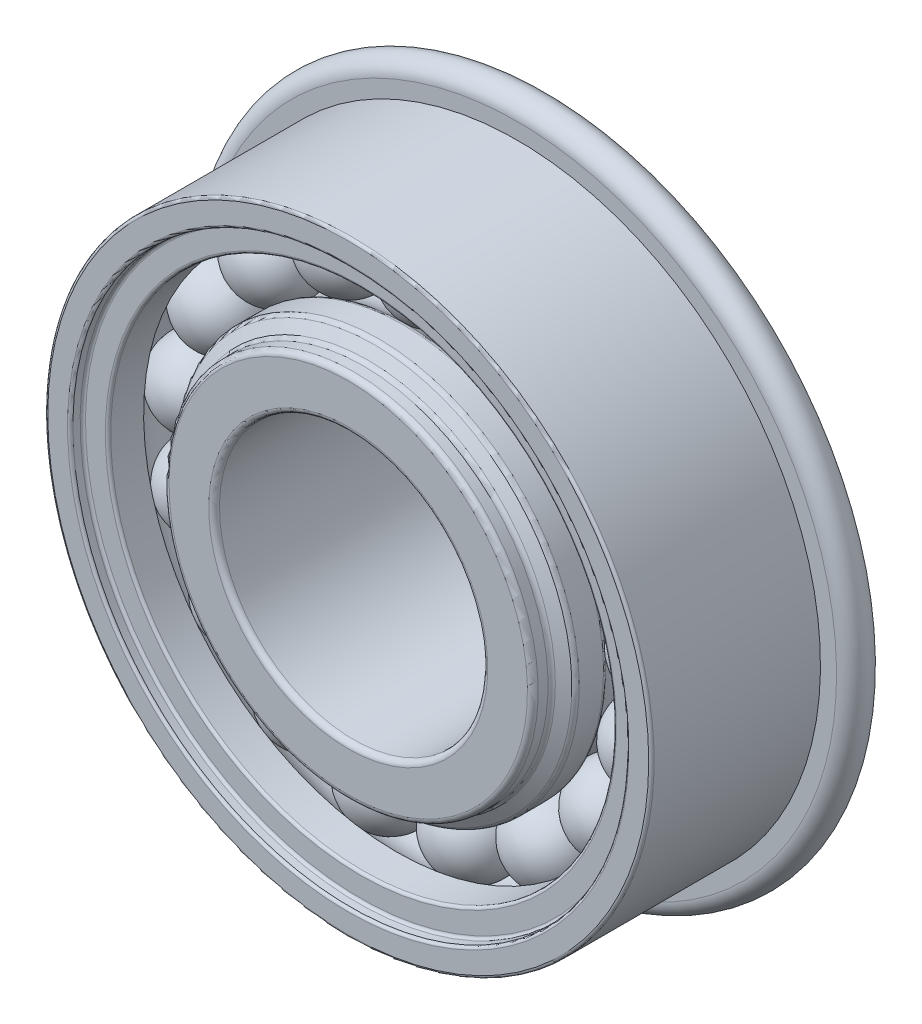
from build123d import *

# Parameters (mm, degrees)
FILLET4_R          = 0.762
CIRPATTERN3_COUNT  = 17
FILLET2_R          = 0.127
FILLET3_R          = 0.127
FILLET5_R          = 0.254
SKETCH12_R         = 13.540581249999997
SKETCH12_R_2       = 11.968162499999998
CUT_EXTRUDE1_DEPTH = 1.143


with BuildPart() as part:
    # Sketch2 → Revolve1 (revolve)
    with BuildSketch(Plane(origin=(0, 0, 0), x_dir=(0, 0, -1), z_dir=(1, 0, 0)), mode=Mode.PRIVATE) as revolve1_sk:
        with BuildLine():
            Line((2.44475, 14.350999999999997), (-5.5562499999999995, 14.350999999999996))
            Line((-5.5562499999999995, 14.350999999999996), (-5.5562499999999995, 13.159581249999999))
            Line((-5.5562499999999995, 13.159581249999999), (-4.960540625000001, 13.159581249999999))
            Line((-4.960540625000001, 13.159581249999999), (-4.960540625000001, 11.9681625))
            Line((-4.960540625000001, 11.9681625), (-3.274269160634745, 11.9681625))
            ThreePointArc((-3.274269160634745, 11.9681625), (-1.55575, 12.96035), (0.1627691606347452, 11.9681625))
            Line((0.1627691606347452, 11.9681625), (3.9687500000000027, 11.9681625))
            Line((3.9687500000000027, 11.9681625), (3.96875, 15.112999999999998))
            ThreePointArc((3.96875, 15.112999999999998), (3.2067500000000018, 15.874999999999998), (2.4447500000000018, 15.113))
            Line((2.4447500000000018, 15.113), (2.44475, 14.350999999999997))
        make_face()
    revolve(revolve1_sk.sketch.rotate(Axis((0, 0, 5.5562499999999995), (0, 1.8e-16, -1)), 180), axis=Axis((0, 0, 5.5562499999999995), (0, 1.8e-16, -1)))

    # Fillet2
    fillet2_edges = [part.edges().sort_by_distance(p)[0] for p in [
        (-2.93e-15, 11.9681625, 4.960540625),
        (-3.22e-15, 13.159581249999999, 4.960540625000002),
    ]]
    fillet(fillet2_edges, radius=FILLET2_R)

    # Fillet3
    fillet3_edges = [part.edges().sort_by_distance(p)[0] for p in [
        (-3.22e-15, 13.159581249999999, 5.55625),
        (-3.51e-15, 14.350999999999996, 5.5562499999999995),
    ]]
    fillet(fillet3_edges, radius=FILLET3_R)

    # Sketch12 → Cut-Extrude1 (cut)
    with BuildSketch(Plane(origin=(0, 7.3e-16, -3.9687500000000044), x_dir=(-1, 0, 0), z_dir=(0, 1.8e-16, -1))):
        with Locations(Location((0, 1.02e-15, 0), (0, 0, 90))):
            Circle(SKETCH12_R)
        with Locations(Location((0, 1.02e-15, 0), (0, 0, 270))):
            Circle(SKETCH12_R_2, mode=Mode.SUBTRACT)
    extrude(amount=-CUT_EXTRUDE1_DEPTH, mode=Mode.SUBTRACT)


with BuildPart() as body_2:
    # Sketch3 → Revolve2 (revolve)
    with BuildSketch(Plane(origin=(0, 0, 0), x_dir=(0, 0, -1), z_dir=(1, 0, 0)), mode=Mode.PRIVATE) as revolve2_sk:
        with BuildLine():
            Line((-5.5562499999999995, 8.7376), (-4.690116343040088, 8.7376))
            Line((-4.690116343040088, 8.7376), (-4.257049514560134, 9.487693750000002))
            Line((-4.257049514560134, 9.487693750000002), (-2.8682906894734495, 9.487693750000002))
            ThreePointArc((-2.8682906894734495, 9.487693750000002), (-1.5557499999999995, 8.991600000000002), (-0.24320931052655032, 9.487693750000002))
            Line((-0.24320931052655032, 9.487693750000002), (2.0116831715200463, 9.487693750000002))
            Line((2.0116831715200463, 9.487693750000002), (2.44475, 8.737600000000002))
            Line((2.44475, 8.737600000000002), (5.55625, 8.7376))
            Line((5.55625, 8.7376), (5.55625, 6.350000000000001))
            Line((5.55625, 6.350000000000001), (-5.5562499999999995, 6.35))
            Line((-5.5562499999999995, 6.35), (-5.5562499999999995, 8.7376))
        make_face()
    revolve(revolve2_sk.sketch.rotate(Axis((0, 0, 5.5562499999999995), (0, 1.8e-16, -1)), 180), axis=Axis((0, 0, 5.5562499999999995), (0, 1.8e-16, -1)))

    # Sketch5 → Cut-Revolve2 (revolve, cut)
    with BuildSketch(Plane(origin=(0, 0, 0), x_dir=(0, 0, -1), z_dir=(1, 0, 0)), mode=Mode.PRIVATE) as cut_revolve2_sk:
        with BuildLine():
            Line((5.55625, 6.9469), (5.55625, 6.350000000000001))
            Line((5.55625, 6.350000000000001), (4.486349594525831, 6.350000000000001))
            Line((4.486349594525831, 6.350000000000001), (4.88662719634144, 6.38501975242221))
            ThreePointArc((4.88662719634144, 6.38501975242221), (5.310018678948872, 6.560394246711456), (5.55625, 6.9469))
        make_face()
    revolve(cut_revolve2_sk.sketch.rotate(Axis((0, 0, 5.5562499999999995), (0, 1.8e-16, -1)), 180), axis=Axis((0, 0, 5.5562499999999995), (0, 1.8e-16, -1)), mode=Mode.SUBTRACT)

    # Sketch6 → Cut-Revolve3 (revolve, cut)
    with BuildSketch(Plane(origin=(0, 0, 0), x_dir=(0, 0, -1), z_dir=(1, 0, 0)), mode=Mode.PRIVATE) as cut_revolve3_sk:
        with BuildLine():
            Line((5.310904840122577, 7.012640037456041), (5.55625, 6.9469))
            Line((5.55625, 6.9469), (5.55625, 7.045510056184058))
            Line((5.55625, 7.045510056184058), (5.188232260183865, 7.0455100561840585))
            ThreePointArc((5.188232260183865, 7.0455100561840585), (5.0651165996583005, 6.852257179539788), (4.853420858354586, 6.764569932395164))
            Line((4.853420858354586, 6.764569932395164), (3.968750000000001, 6.687171261337388))
            Line((3.968750000000001, 6.687171261337388), (3.96875, 6.559686141969385))
            Line((3.96875, 6.559686141969385), (4.864489637683538, 6.638053205737512))
            ThreePointArc((4.864489637683538, 6.638053205737512), (5.146750626088492, 6.754969535263678), (5.310904840122577, 7.012640037456041))
        make_face()
    revolve(cut_revolve3_sk.sketch.rotate(Axis((0, 0, 5.5562499999999995), (0, 1.8e-16, -1)), 180), axis=Axis((0, 0, 5.5562499999999995), (0, 1.8e-16, -1)), mode=Mode.SUBTRACT)

    # Fillet4
    # the kernel refuses this fillet: 0.762 mm, written as the material it takes off along each edge
    with BuildSketch(Plane(origin=(0, 2.04e-15, -5.556250000000001), x_dir=(1.2e-16, -1, -1.3e-16), z_dir=(1, 1.2e-16, 0))) as fillet4_piece_1:
        with BuildLine():
            CenterArc((7.697753859267347, -0.7619999999999979), FILLET4_R, 90, 58.86628583256041)
            Line((7.045510056184135, -0.3680177398161817), (7.032465180122471, -0.36013809461250545))
            ThreePointArc((7.032465180122471, -0.36013809461250545), (7.030270056184055, -0.18400886990808996), (7.030270056184055, 8.9e-16))
            Line((7.030270056184055, 8.9e-16), (7.045510056184056, 0.01524000000000125))
            Line((7.045510056184056, 0.01524000000000125), (7.697753859267347, 0.01524000000000295))
            Line((7.697753859267347, 0.01524000000000295), (7.697753859267347, 2.58e-15))
        make_face()
    revolve(axis=Axis((0, 2.04e-15, -5.556250000000001), (0, 1.8e-16, -1)), mode=Mode.SUBTRACT)

    # Sketch14 → Revolve4 (revolve)
    with BuildSketch(Plane(origin=(0, 0, 0), x_dir=(0, 0, -1), z_dir=(1, 0, 0)), mode=Mode.PRIVATE) as revolve4_sk:
        with BuildLine():
            Line((4.486349594525832, 6.350000000000002), (4.778354774951089, 6.350000000000003))
            ThreePointArc((4.778354774951089, 6.350000000000003), (5.26861251103332, 6.516420076453832), (5.556250000000002, 6.9469))
            Line((5.556250000000002, 6.9469), (5.433577420061289, 6.979770018728019))
            ThreePointArc((5.433577420061289, 6.979770018728019), (5.13515953827062, 6.578421647285627), (4.642781425733349, 6.49068601184526))
            Line((4.642781425733349, 6.49068601184526), (4.486349594525832, 6.477000000000003))
            Line((4.486349594525832, 6.477000000000003), (4.486349594525832, 6.350000000000002))
        make_face()
    revolve(revolve4_sk.sketch.rotate(Axis((0, 1.38e-15, -3.843895860272255), (0, -3.1e-16, 1)), 180), axis=Axis((0, 1.38e-15, -3.843895860272255), (0, -3.1e-16, 1)))

    # Sketch7 → Cut-Revolve4 (revolve, cut)
    with BuildSketch(Plane(origin=(0, 0, 0), x_dir=(0, 0, -1), z_dir=(1, 0, 0)), mode=Mode.PRIVATE) as cut_revolve4_sk:
        Polygon((5.55625, 8.140699999999999), (5.55625, 8.7376), (5.357283333333334, 8.7376), (5.357283333333334, 8.538633333333333), (5.357283333333334, 8.339666666666666), (5.357283333333334, 8.140699999999999), align=None)
    revolve(cut_revolve4_sk.sketch.rotate(Axis((0, 0, 5.5562499999999995), (0, 1.8e-16, -1)), 180), axis=Axis((0, 0, 5.5562499999999995), (0, 1.8e-16, -1)), mode=Mode.SUBTRACT)

    # Fillet5
    # the kernel refuses this fillet: 0.254 mm, written as the material it adds along each edge
    with BuildSketch(Plane(origin=(0, 1.6e-16, 4.690116343040086), x_dir=(1.2e-16, -1, -2e-16), z_dir=(1, 1.2e-16, 0))) as fillet5_piece_1:
        with BuildLine():
            CenterArc((8.7376 + FILLET5_R, -FILLET5_R * 0.57735026919), FILLET5_R, 120.00000000000017, 59.99999999999983)
            Line((8.7376 + FILLET5_R * 0.5, FILLET5_R * 0.288675134595), (8.7376, 0))
            Line((8.7376, 0), (8.7376, -FILLET5_R * 0.57735026919))
        make_face()
    revolve(axis=Axis((0, 1.6e-16, 4.690116343040086), (0, 1.8e-16, -1)))
    with BuildSketch(Plane(origin=(0, 1.47e-15, -2.4447500000000018), x_dir=(1.2e-16, -1, -2e-16), z_dir=(1, 1.2e-16, 0))) as fillet5_piece_2:
        with BuildLine():
            CenterArc((8.7376 + FILLET5_R, FILLET5_R * 0.57735026919), FILLET5_R, 180.00000000000028, 60.00000000000006)
            Line((8.7376, FILLET5_R * 0.57735026919), (8.7376, -4.4e-16))
            Line((8.7376, -4.4e-16), (8.7376 + FILLET5_R * 0.5, -FILLET5_R * 0.288675134595))
        make_face()
    revolve(axis=Axis((0, 1.47e-15, -2.4447500000000018), (0, 1.8e-16, -1)))
    # the kernel refuses this fillet: 0.254 mm, written as the material it takes off along each edge
    with BuildSketch(Plane(origin=(0, 0, 5.556249999999998), x_dir=(1.2e-16, -1, -1.4e-16), z_dir=(1, 1.2e-16, 0))) as fillet5_2_piece_1:
        with BuildLine():
            CenterArc((6.35 + FILLET5_R, FILLET5_R), FILLET5_R, 180.00000000000017, 89.99999999999983)
            Line((6.35, FILLET5_R), (6.35, 8.9e-16))
            Line((6.35, 8.9e-16), (6.35 + FILLET5_R, 8.5e-16))
        make_face()
    revolve(axis=Axis((0, 0, 5.556249999999998), (0, 1.8e-16, -1)), mode=Mode.SUBTRACT)
    with BuildSketch(Plane(origin=(0, 2.04e-15, -5.556250000000001), x_dir=(1.2e-16, -1, -2.2e-16), z_dir=(1, 1.2e-16, 0))) as fillet5_2_piece_2:
        with BuildLine():
            CenterArc((7.892733606666686, -0.2539999999999995), FILLET5_R, 12.513325362831626, 77.48667463716838)
            Line((7.892733606666686, 5e-17), (8.140699999999997, -8.9e-16))
            Line((8.140699999999997, -8.9e-16), (8.14069999999902, -0.198966666666883))
        make_face()
    revolve(axis=Axis((0, 2.04e-15, -5.556250000000001), (0, 1.8e-16, -1)), mode=Mode.SUBTRACT)
    with BuildSketch(Plane(origin=(0, 2e-15, -5.357283333333336), x_dir=(1.2e-16, -1, -2e-16), z_dir=(1, 1.2e-16, 0))) as fillet5_2_piece_3:
        with BuildLine():
            CenterArc((8.737599999999999 - FILLET5_R, -FILLET5_R), FILLET5_R, 1.8783e-13, 90.00000000000061)
            Line((8.737599999999999 - FILLET5_R, 9.4e-16), (8.737599999999999, 0))
            Line((8.737599999999999, 0), (8.7376, -FILLET5_R))
        make_face()
    revolve(axis=Axis((0, 2e-15, -5.357283333333336), (0, 1.8e-16, -1)), mode=Mode.SUBTRACT)
    with BuildSketch(Plane(origin=(0, 0, 5.556249999999998), x_dir=(1.2e-16, -1, -2e-16), z_dir=(1, 1.2e-16, 0))) as fillet5_2_piece_4:
        with BuildLine():
            CenterArc((8.7376 - FILLET5_R, FILLET5_R), FILLET5_R, 270, 90.00000000000017)
            Line((8.7376 - FILLET5_R, -8.4e-16), (8.7376, 0))
            Line((8.7376, 0), (8.7376, FILLET5_R))
        make_face()
    revolve(axis=Axis((0, 0, 5.556249999999998), (0, 1.8e-16, -1)), mode=Mode.SUBTRACT)
    with BuildSketch(Plane(origin=(0, 2.4e-16, 4.257049514560133), x_dir=(1.2e-16, -1, -1.9e-16), z_dir=(1, 1.2e-16, 0))) as fillet5_2_piece_5:
        with BuildLine():
            CenterArc((9.487693750000002 - FILLET5_R, FILLET5_R * 0.57735026919), FILLET5_R, 299.9999999999997, 60.00000000000028)
            Line((9.48769375, FILLET5_R * 0.57735026919), (9.487693750000002, 0))
            Line((9.487693750000002, 0), (9.487693750000002 - FILLET5_R * 0.5, -FILLET5_R * 0.288675134595))
        make_face()
    revolve(axis=Axis((0, 2.4e-16, 4.257049514560133), (0, 1.8e-16, -1)), mode=Mode.SUBTRACT)
    with BuildSketch(Plane(origin=(0, 4.9e-16, 2.8682906894734477), x_dir=(1.2e-16, -1, -1.9e-16), z_dir=(1, 1.2e-16, 0))) as fillet5_2_piece_6:
        with BuildLine():
            CenterArc((9.233693750000002, -0.09272750077474741), FILLET5_R, 360, 38.888534569344074)
            ThreePointArc((9.431399423758867, 0.06673555627469387), (9.459179515850213, 0.03305813785822177), (9.487693750000002, 0))
            Line((9.487693750000002, 0), (9.487693750000002, -0.09272750077474745))
        make_face()
    revolve(axis=Axis((0, 4.9e-16, 2.8682906894734477), (0, 1.8e-16, -1)), mode=Mode.SUBTRACT)
    with BuildSketch(Plane(origin=(0, 9.8e-16, 0.2432093105265487), x_dir=(1.2e-16, -1, -1.8e-16), z_dir=(1, 1.2e-16, 0))) as fillet5_2_piece_7:
        with BuildLine():
            CenterArc((9.233693750000002, 0.0927275007747528), FILLET5_R, 321.1114654306559, 38.888534569344124)
            Line((9.487693750000002, 0.09272750077475314), (9.487693750000002, 0))
            ThreePointArc((9.487693750000002, 0), (9.459179515850213, -0.03305813785821739), (9.431399423758867, -0.06673555627468837))
        make_face()
    revolve(axis=Axis((0, 9.8e-16, 0.2432093105265487), (0, 1.8e-16, -1)), mode=Mode.SUBTRACT)


with BuildPart() as body_3:
    # Sketch11 → Revolve3 (revolve)
    with BuildSketch(Plane(origin=(0, 0, 0), x_dir=(0, 0, -1), z_dir=(1, 0, 0))):
        with BuildLine():
            Line((-1.5557499999999997, 12.96035), (-1.5557499999999993, 8.9916))
            ThreePointArc((-1.5557499999999993, 8.9916), (0.42862500000000026, 10.975975), (-1.5557499999999997, 12.96035))
        make_face()
    revolve(axis=Axis((0, 12.96035, 1.5557499999999997), (0, -1, -1.1e-16)))


with BuildPart() as cirpattern3_1:
    # CirPattern3: pattern copy
    add(body_3.part.rotate(Axis((1e-16, -4.9e-16, 0), (0, 0, 1)), 1 * 360 / CIRPATTERN3_COUNT))


with BuildPart() as cirpattern3_2:
    # CirPattern3: pattern copy
    add(body_3.part.rotate(Axis((1e-16, -4.9e-16, 0), (0, 0, 1)), 2 * 360 / CIRPATTERN3_COUNT))


with BuildPart() as cirpattern3_3:
    # CirPattern3: pattern copy
    add(body_3.part.rotate(Axis((1e-16, -4.9e-16, 0), (0, 0, 1)), 3 * 360 / CIRPATTERN3_COUNT))


with BuildPart() as cirpattern3_4:
    # CirPattern3: pattern copy
    add(body_3.part.rotate(Axis((1e-16, -4.9e-16, 0), (0, 0, 1)), 4 * 360 / CIRPATTERN3_COUNT))


with BuildPart() as cirpattern3_5:
    # CirPattern3: pattern copy
    add(body_3.part.rotate(Axis((1e-16, -4.9e-16, 0), (0, 0, 1)), 5 * 360 / CIRPATTERN3_COUNT))


with BuildPart() as cirpattern3_6:
    # CirPattern3: pattern copy
    add(body_3.part.rotate(Axis((1e-16, -4.9e-16, 0), (0, 0, 1)), 6 * 360 / CIRPATTERN3_COUNT))


with BuildPart() as cirpattern3_7:
    # CirPattern3: pattern copy
    add(body_3.part.rotate(Axis((1e-16, -4.9e-16, 0), (0, 0, 1)), 7 * 360 / CIRPATTERN3_COUNT))


with BuildPart() as cirpattern3_8:
    # CirPattern3: pattern copy
    add(body_3.part.rotate(Axis((1e-16, -4.9e-16, 0), (0, 0, 1)), 8 * 360 / CIRPATTERN3_COUNT))


with BuildPart() as cirpattern3_9:
    # CirPattern3: pattern copy
    add(body_3.part.rotate(Axis((1e-16, -4.9e-16, 0), (0, 0, 1)), 9 * 360 / CIRPATTERN3_COUNT))


with BuildPart() as cirpattern3_10:
    # CirPattern3: pattern copy
    add(body_3.part.rotate(Axis((1e-16, -4.9e-16, 0), (0, 0, 1)), 10 * 360 / CIRPATTERN3_COUNT))


with BuildPart() as cirpattern3_11:
    # CirPattern3: pattern copy
    add(body_3.part.rotate(Axis((1e-16, -4.9e-16, 0), (0, 0, 1)), 11 * 360 / CIRPATTERN3_COUNT))


with BuildPart() as cirpattern3_12:
    # CirPattern3: pattern copy
    add(body_3.part.rotate(Axis((1e-16, -4.9e-16, 0), (0, 0, 1)), 12 * 360 / CIRPATTERN3_COUNT))


with BuildPart() as cirpattern3_13:
    # CirPattern3: pattern copy
    add(body_3.part.rotate(Axis((1e-16, -4.9e-16, 0), (0, 0, 1)), 13 * 360 / CIRPATTERN3_COUNT))


with BuildPart() as cirpattern3_14:
    # CirPattern3: pattern copy
    add(body_3.part.rotate(Axis((1e-16, -4.9e-16, 0), (0, 0, 1)), 14 * 360 / CIRPATTERN3_COUNT))


with BuildPart() as cirpattern3_15:
    # CirPattern3: pattern copy
    add(body_3.part.rotate(Axis((1e-16, -4.9e-16, 0), (0, 0, 1)), 15 * 360 / CIRPATTERN3_COUNT))


with BuildPart() as cirpattern3_16:
    # CirPattern3: pattern copy
    add(body_3.part.rotate(Axis((1e-16, -4.9e-16, 0), (0, 0, 1)), 16 * 360 / CIRPATTERN3_COUNT))


solid = Compound([part.part, body_2.part, body_3.part, cirpattern3_1.part, cirpattern3_2.part, cirpattern3_3.part, cirpattern3_4.part, cirpattern3_5.part, cirpattern3_6.part, cirpattern3_7.part, cirpattern3_8.part, cirpattern3_9.part, cirpattern3_10.part, cirpattern3_11.part, cirpattern3_12.part, cirpattern3_13.part, cirpattern3_14.part, cirpattern3_15.part, cirpattern3_16.part])
